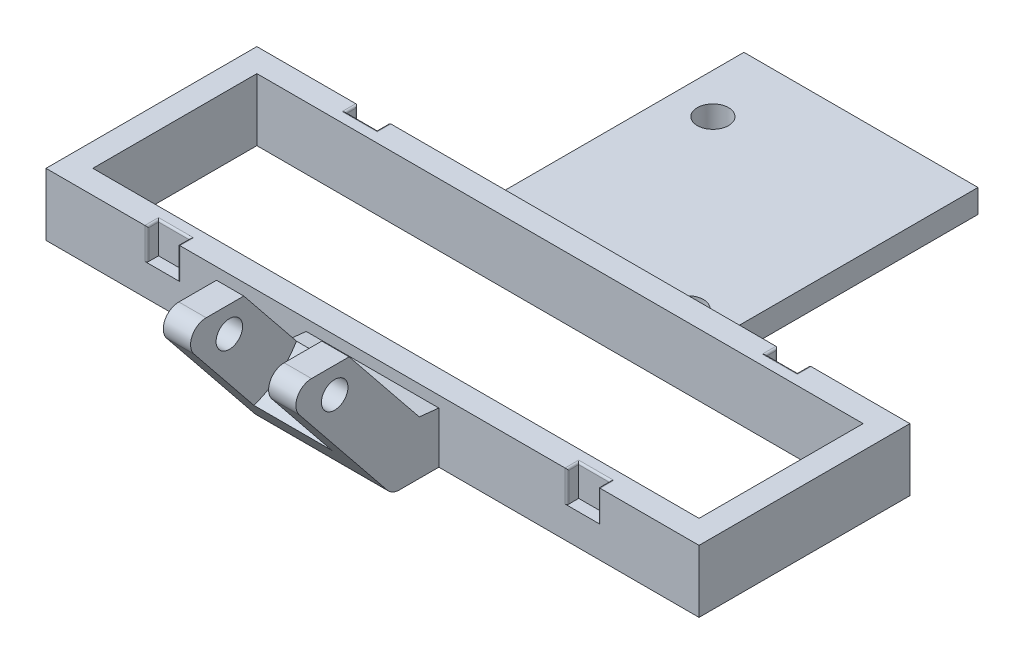
from build123d import *

# Parameters (mm, degrees)
SKETCH5_W           = 77.7
SKETCH5_H           = 21.028
BOSS_EXTRUDE3_DEPTH = 8
SKETCH6_W           = 30
SKETCH6_H           = 35.57641867
CUT_EXTRUDE4_DEPTH  = 5
SKETCH10_R          = 1.7
CUT_EXTRUDE5_DEPTH  = 17
FILLET4_R           = 2
FILLET5_R           = 2
CHAMFER1_START      = 6.5
CHAMFER1_DEPTH      = 17
SKETCH11_R          = 10
CUT_EXTRUDE6_DEPTH  = 5
SKETCH12_R          = 2
CUT_EXTRUDE7_DEPTH  = 3
SKETCH13_W          = 4
SKETCH13_H          = 1.5
CUT_EXTRUDE8_DEPTH  = 4
FILLET6_R           = 0.25


with BuildPart() as part:
    # Sketch5 → Boss-Extrude3 (new body)
    with BuildSketch(Plane(origin=(0, 0, 0), x_dir=(1, 0, 0), z_dir=(0, 1, 0))):
        Polygon((30, -35.57641867), (56.85, -35.57641867), (56.85, -62.60441867), (-26.85, -62.60441867), (-26.85, -35.57641867), (0, -35.57641867), (0, 0), (30, 0), align=None)
        with Locations((15, -49.09041867)):
            Rectangle(SKETCH5_W, SKETCH5_H, mode=Mode.SUBTRACT)
    extrude(amount=BOSS_EXTRUDE3_DEPTH)

    # Sketch6 → Cut-Extrude4 (cut)
    with BuildSketch(Plane(origin=(0, 8, 0), x_dir=(1, 0, 0), z_dir=(0, 1, 0))):
        with Locations((15, -17.788209335)):
            Rectangle(SKETCH6_W, SKETCH6_H)
    extrude(amount=-CUT_EXTRUDE4_DEPTH, mode=Mode.SUBTRACT)

    # Sketch7 → Loft1 section 0
    with BuildSketch(Plane.XZ):
        with BuildLine():
            Line((6.5, 59.60441867), (23.5, 59.60441867))
            Line((23.5, 59.60441867), (23.5, 68.60441867))
            Line((23.5, 68.60441867), (6.5, 68.60441867))
            Line((6.5, 68.60441867), (6.5, 59.60441867))
        make_face()
    # Sketch9 → Loft1 section 1
    with BuildSketch(Plane(origin=(0, 18, 0), x_dir=(-1, 0, 0), z_dir=(0, -1, 0))):
        with BuildLine():
            Line((-23.5, -83.10441867), (-6.5, -83.10441867))
            Line((-6.5, -83.10441867), (-6.5, -74.10441867))
            Line((-6.5, -74.10441867), (-23.5, -74.10441867))
            Line((-23.5, -74.10441867), (-23.5, -83.10441867))
        make_face()
    loft()

    # Sketch10 → Cut-Extrude5 (cut)
    with BuildSketch(Plane(origin=(23.5, 0, 0), x_dir=(0, 0, -1), z_dir=(1, 0, 0))):
        with Locations(Location((-75.953844744, 14.709632368, 0), (0, 0, 90))):
            Circle(SKETCH10_R)
    extrude(amount=-CUT_EXTRUDE5_DEPTH, mode=Mode.SUBTRACT)

    # Fillet4
    fillet4_edges = [part.edges().sort_by_distance(p)[0] for p in [
        (15, 0, 68.60441867),
    ]]
    fillet(fillet4_edges, radius=FILLET4_R)

    # Fillet5
    fillet5_edges = [part.edges().sort_by_distance(p)[0] for p in [
        (15, 18, 83.10441867),
    ]]
    fillet(fillet5_edges, radius=FILLET5_R)

    # Chamfer1: read off the stored shape, not the designer's step
    # Chamfer1 outline → Chamfer1 (add)
    with BuildSketch(Plane.YZ.offset(CHAMFER1_START)):
        Polygon((6.568919305, 62.60441867), (6.839153567, 65.113736821), (3.724137931, 62.60441867), align=None)
    extrude(amount=CHAMFER1_DEPTH)

    # Sketch11 → Cut-Extrude6 (cut, symmetric)
    with BuildSketch(Plane(origin=(15, 0, 0), x_dir=(0, 0, -1), z_dir=(1, 0, 0))):
        with Locations((-75.953844744, 14.709632368)):
            Circle(SKETCH11_R)
    extrude(amount=CUT_EXTRUDE6_DEPTH, both=True, mode=Mode.SUBTRACT)

    # Sketch12 → Cut-Extrude7 (cut)
    with BuildSketch(Plane(origin=(0, 3, 0), x_dir=(1, 0, 0), z_dir=(0, 1, 0))):
        with Locations(Location((24.85, -32.02641867, 0), (0, 0, 270))):
            Circle(SKETCH12_R)
        with Locations(Location((5.15, -9.12641867, 0), (0, 0, 270))):
            Circle(SKETCH12_R)
    extrude(amount=-CUT_EXTRUDE7_DEPTH, mode=Mode.SUBTRACT)

    # Sketch13 → Cut-Extrude8 (cut)
    with BuildSketch(Plane(origin=(0, 8, 0), x_dir=(1, 0, 0), z_dir=(0, 1, 0))):
        with Locations((-11.925, -36.32641867)):
            Rectangle(SKETCH13_W, SKETCH13_H)
        with Locations((-11.925, -61.85441867)):
            Rectangle(SKETCH13_W, SKETCH13_H)
        with Locations((41.925, -61.85441867)):
            Rectangle(SKETCH13_W, SKETCH13_H)
        with Locations((41.925, -36.32641867)):
            Rectangle(SKETCH13_W, SKETCH13_H)
    extrude(amount=-CUT_EXTRUDE8_DEPTH, mode=Mode.SUBTRACT)

    # Fillet6
    fillet6_edges = [part.edges().sort_by_distance(p)[0] for p in [
        (-9.925, 6, 62.60441867),
        (-13.925, 6, 62.60441867),
        (-9.925, 8, 61.85441867),
        (-11.925, 8, 61.10441867),
        (-13.925, 8, 61.85441867),
        (39.925, 6, 35.57641867),
        (43.925, 6, 35.57641867),
        (39.925, 8, 36.32641867),
        (41.925, 8, 37.07641867),
        (43.925, 8, 36.32641867),
        (39.925, 6, 62.60441867),
        (43.925, 6, 62.60441867),
        (39.925, 8, 61.85441867),
        (43.925, 8, 61.85441867),
        (41.925, 8, 61.10441867),
        (-9.925, 6, 35.57641867),
        (-13.925, 6, 35.57641867),
        (-9.925, 8, 36.32641867),
        (-13.925, 8, 36.32641867),
        (-11.925, 8, 37.07641867),
    ]]
    fillet(fillet6_edges, radius=FILLET6_R)


solid = part.part
